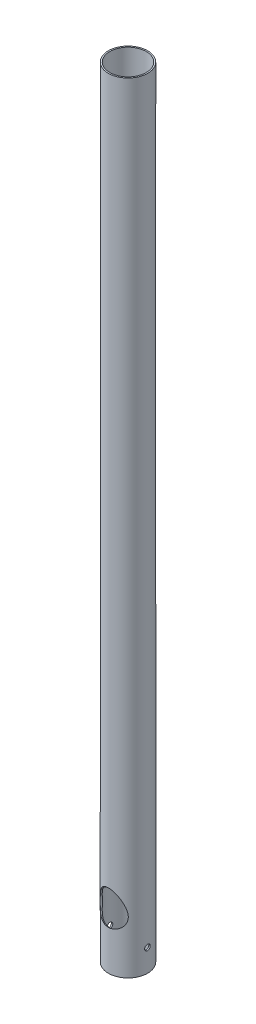
from build123d import *

# Parameters (mm, degrees)
EXTRUDE_1_OUTLINE_R      = 70
EXTRUDE_1_OUTLINE_R_2    = 65
EXTRUDE_1_DEPTH          = 2780
CUT_EXTRUDE_3_DEPTH      = 2782.762031519
CUT_EXTRUDE_3_DEPTH_BACK = 2782.762031519
SKETCH_6_R               = 10
SKETCH_7_R               = 50
CUT_EXTRUDE_4_DEPTH      = 200
SKETCH_13_R              = 52.5
CUT_EXTRUDE_8_DEPTH      = 200


# Read off the part's stored shape, not the designer's step: Вытянуть-Тонкостенный1
with BuildPart() as part:
    # Вытянуть-Тонкостенный1 outline → Вытянуть-Тонкостенный1 (new body)
    with BuildSketch(Plane(origin=(0, 0, 0), x_dir=(1, 0, 0), z_dir=(0, 1, 0))):
        Circle(EXTRUDE_1_OUTLINE_R)
        Circle(EXTRUDE_1_OUTLINE_R_2, mode=Mode.SUBTRACT)
    extrude(amount=EXTRUDE_1_DEPTH)

    # Эскиз6 → Вырез-Вытянуть3 (cut, two sides: drawn at the far end of the back side and taken through both)
    with BuildSketch(Plane(origin=(0, 0, 0), x_dir=(0, 0, -1), z_dir=(1, 0, 0)).offset(-CUT_EXTRUDE_3_DEPTH_BACK)):
        with Locations((0, 80)):
            Circle(SKETCH_6_R)
    extrude(amount=CUT_EXTRUDE_3_DEPTH + CUT_EXTRUDE_3_DEPTH_BACK, mode=Mode.SUBTRACT)

    # Эскиз7 → Вырез-Вытянуть4 (cut)
    with BuildSketch(Plane(origin=(0, 176.689515805, 252.338779809), x_dir=(1, 0, 0), z_dir=(0, -0.5735764363510416, -0.8191520442889949))):
        with Locations(Location((0, -126.118813858, 0), (0, 0, 90))):
            Circle(SKETCH_7_R)
    extrude(amount=CUT_EXTRUDE_4_DEPTH, mode=Mode.SUBTRACT)

    # Эскиз13 → Вырез-Вытянуть8 (cut)
    with BuildSketch(Plane(origin=(0, 750.265952156, 1071.490824098), x_dir=(1, 0, 0), z_dir=(0, -0.5735764363510416, -0.8191520442889949))):
        with Locations(Location((0, -2185, 0), (0, 0, 270))):
            Circle(SKETCH_13_R)
    extrude(amount=-CUT_EXTRUDE_8_DEPTH, mode=Mode.SUBTRACT)


solid = part.part
